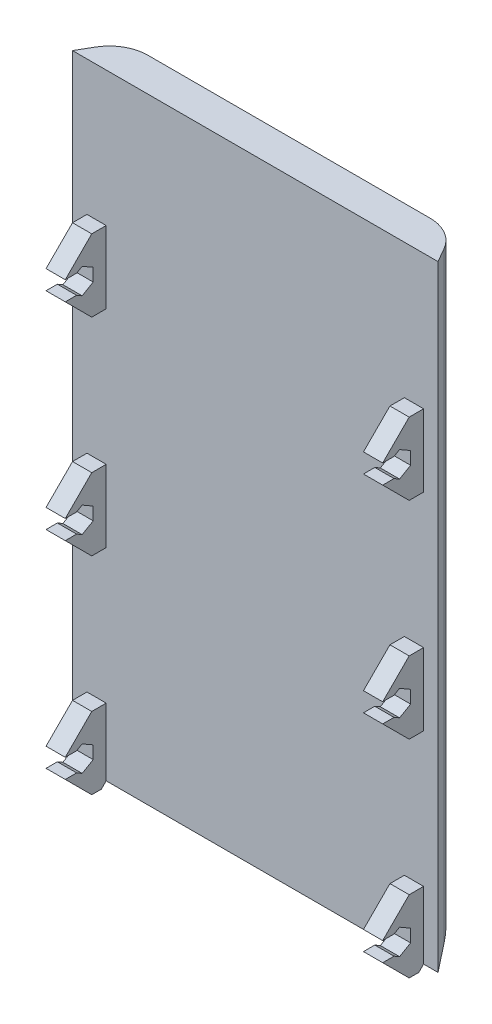
from build123d import *

# Parameters (mm, degrees)
BOSS_EXTRUDE1_DEPTH = 129
SKETCH4_W           = 37.518488727
SKETCH4_H           = 28
CUT_EXTRUDE1_DEPTH  = 149.559752288
SKETCH5_W           = 33.314858612
SKETCH5_H           = 28
CUT_EXTRUDE2_DEPTH  = 149.559752288
CUT_EXTRUDE3_DEPTH  = 145.255019101
LPATTERN1_COUNT     = 4
LPATTERN1_PITCH     = 43
CHAMFER6_SIZE       = 8
FILLET1_R           = 8
CHAMFER5_SIZE       = 7
CUT_EXTRUDE4_DEPTH  = 1


with BuildPart() as part:
    # Sketch1 → Boss-Extrude1 (new body)
    with BuildSketch(Plane(origin=(0, 0, 0), x_dir=(1, 0, 0), z_dir=(0, 1, 0))):
        Polygon((-9.215122984, 0), (-9.215122984, -10), (-5.215122984, -10), (-5.215122984, 0), (56.784877016, 0), (56.784877016, -10), (60.784877016, -10), (60.784877016, 0), (63.784877016, 0), (59.743425131, 7), (-8.1736711, 7), (-12.215122984, 0), align=None)
    extrude(amount=BOSS_EXTRUDE1_DEPTH)

    # Sketch4 → Cut-Extrude1 (cut, through all)
    with BuildSketch(Plane(origin=(60.784877016, 0, 0), x_dir=(0, 0, -1), z_dir=(1, 0, 0))):
        with Locations((-18.759244364, 115)):
            Rectangle(SKETCH4_W, SKETCH4_H)
    extrude(amount=-CUT_EXTRUDE1_DEPTH, mode=Mode.SUBTRACT)

    # Sketch5 → Cut-Extrude2 (cut, through all)
    with BuildSketch(Plane(origin=(60.784877016, 0, 0), x_dir=(0, 0, -1), z_dir=(1, 0, 0))):
        with Locations((-16.657429306, 72)):
            Rectangle(SKETCH5_W, SKETCH5_H)
    cut_extrude2 = extrude(amount=-CUT_EXTRUDE2_DEPTH, mode=Mode.SUBTRACT)

    # Sketch6 → Cut-Extrude3 (cut, symmetric)
    with BuildSketch(Plane(origin=(0, 0, 0), x_dir=(0, 0, -1), z_dir=(1, 0, 0))):
        Polygon((-7.3, 94.827905619), (-6.15, 95.491858429), (-10, 95.491858429), (-10, 91.508141571), (-6.15, 91.508141571), (-7.3, 92.172094381), align=None)
        Polygon((-5, 90.844188762), (-2.7, 92.172094381), (-2.7, 94.827905619), (-5, 96.155811238), (-7.3, 94.827905619), (-7.3, 92.172094381), align=None)
    cut_extrude3 = extrude(amount=CUT_EXTRUDE3_DEPTH, both=True, mode=Mode.SUBTRACT)

    # LPattern1: Cut-Extrude2, Cut-Extrude3 ×4
    with Locations(*[(0, -i * LPATTERN1_PITCH, 0) for i in range(1, LPATTERN1_COUNT)]):
        add(cut_extrude2, mode=Mode.SUBTRACT)
        add(cut_extrude3, mode=Mode.SUBTRACT)

    # Chamfer6
    # the kernel refuses this chamfer: 8 mm, written as the material it takes off along each edge
    with BuildSketch(Plane(origin=(80.316889035, 0, -7), x_dir=(0, -0.027495876610586365, 0.9996219169112968), z_dir=(-1, 0, 0))) as chamfer6_piece_1:
        Polygon((CHAMFER6_SIZE * 0.999621916911, CHAMFER6_SIZE * 0.0274958766106), (-CHAMFER6_SIZE * 0.0274958766106, CHAMFER6_SIZE * 0.999621916911), (0, 0), align=None)
    extrude(amount=109.064024039, mode=Mode.SUBTRACT)

    # Fillet1
    fillet1_edges = [part.edges().sort_by_distance(p)[0] for p in [
        (-8.1736711, 68.5, -7),
        (59.743425131, 68.5, -7),
    ]]
    fillet(fillet1_edges, radius=FILLET1_R)

    # Chamfer5
    # the kernel refuses this chamfer: 7 mm, written as the material it takes off along each edge
    with BuildSketch(Plane(origin=(38.7830961, 101, 10), x_dir=(0, 0.02749587661058612, -0.9996219169112968), z_dir=(1, 0, 0)), Plane(origin=(78.786657931, 86, 10), x_dir=(0, -0.027495876610586133, -0.9996219169112968), z_dir=(-1, 0, 0)), Plane(origin=(-27.2169039, 101, 10), x_dir=(0, 0.02749587661058612, -0.9996219169112968), z_dir=(1, 0, 0)), Plane(origin=(12.786657931, 86, 10), x_dir=(0, -0.027495876610586133, -0.9996219169112968), z_dir=(-1, 0, 0)), Plane(origin=(-27.2169039, 58, 10), x_dir=(0, 0.02749587661058612, -0.9996219169112968), z_dir=(1, 0, 0)), Plane(origin=(12.786657931, 43, 10), x_dir=(0, -0.027495876610586133, -0.9996219169112968), z_dir=(-1, 0, 0)), Plane(origin=(38.7830961, 58, 10), x_dir=(0, 0.02749587661058612, -0.9996219169112968), z_dir=(1, 0, 0)), Plane(origin=(78.786657931, 43, 10), x_dir=(0, -0.027495876610586133, -0.9996219169112968), z_dir=(-1, 0, 0)), Plane(origin=(38.7830961, 15, 10), x_dir=(0, 0.027495876610586365, -0.9996219169112968), z_dir=(1, 0, 0)), Plane(origin=(-27.2169039, 15, 10), x_dir=(0, 0.027495876610586365, -0.9996219169112968), z_dir=(1, 0, 0))) as chamfer5_piece_1:
        Polygon((CHAMFER5_SIZE * 0.999621916911, -CHAMFER5_SIZE * 0.0274958766106), (-CHAMFER5_SIZE * 0.0274958766106, -CHAMFER5_SIZE * 0.999621916911), (0, 0), align=None)
    extrude(amount=40.003561832, mode=Mode.SUBTRACT)
    with BuildSketch(Plane(origin=(38.7830961, 0, 10), x_dir=(0, -0.027495876610586376, -0.9996219169112968), z_dir=(1, 0, 0)), Plane(origin=(-27.2169039, 0, 10), x_dir=(0, -0.027495876610586376, -0.9996219169112968), z_dir=(1, 0, 0))) as chamfer5_piece_2:
        Polygon((CHAMFER5_SIZE * 0.999621916911, CHAMFER5_SIZE * 0.0274958766106), (-CHAMFER5_SIZE * 0.0274958766106, CHAMFER5_SIZE * 0.999621916911), (0, 0), align=None)
    extrude(amount=40.003561832, mode=Mode.SUBTRACT)

    # Sketch7 → Cut-Extrude4 (cut)
    # profile 1 of 7: a face of its own
    with BuildSketch(Plane(origin=(0, 0, -7), x_dir=(-1, 0, 0), z_dir=(0, 0, -1))):
        with BuildLine():
            Line((-27.458475756, 32.582937459), (-27.458475756, 23.255194994))
            add(Edge.make_bspline(
                [(-27.458475756, 23.255194994), (-27.459017719, 23.212565537), (-27.460030236, 23.132923345), (-27.479098997, 23.021984657), (-27.506487406, 22.926367391), (-27.54774344, 22.846359182), (-27.6036122, 22.784415703), (-27.671482176, 22.741882124), (-27.749749274, 22.713852669), (-27.806287603, 22.711949052), (-27.836064438, 22.710946481)],
                knots=[0, 0, 0, 0, 1.358012499, 2.537097539, 3.579489737, 4.521000185, 5.383446546, 6.205375314, 7.054831608, 8, 8, 8, 8], degree=3))
            Line((-27.836064438, 22.710946481), (-30.427104011, 22.710946481))
            add(Edge.make_bspline(
                [(-30.427104011, 22.710946481), (-30.469047088, 22.71266857), (-30.553454293, 22.716134141), (-30.678279457, 22.754226692), (-30.80439822, 22.807034058), (-30.881912253, 22.860472058), (-30.921875387, 22.888022552)],
                knots=[0, 0, 0, 0, 0.939454731, 1.890580155, 2.912467545, 4, 4, 4, 4], degree=3))
            Line((-30.921875387, 22.888022552), (-33.791549367, 25.114493744))
            Line((-33.791549367, 25.114493744), (-36.616954329, 22.921875331))
            add(Edge.make_bspline(
                [(-36.616954329, 22.921875331), (-36.664060971, 22.890432662), (-36.753824493, 22.830517446), (-36.891123432, 22.761854433), (-37.024995762, 22.719025322), (-37.113182283, 22.713586768), (-37.155994723, 22.710946481)],
                knots=[0, 0, 0, 0, 1.155467548, 2.201787915, 3.127011172, 4, 4, 4, 4], degree=3))
            Line((-37.155994723, 22.710946481), (-39.747034296, 22.710946481))
            add(Edge.make_bspline(
                [(-39.747034296, 22.710946481), (-39.776811131, 22.711949052), (-39.83334946, 22.713852669), (-39.911616558, 22.741882124), (-39.979486534, 22.784415703), (-40.035355294, 22.846359182), (-40.076611327, 22.926367391), (-40.103999736, 23.021984657), (-40.123068498, 23.132923345), (-40.124081015, 23.212565537), (-40.124622978, 23.255194994)],
                knots=[0, 0, 0, 0, 0.945168392, 1.794624686, 2.616553454, 3.478999815, 4.420510263, 5.462902461, 6.641987501, 8, 8, 8, 8], degree=3))
            Line((-40.124622978, 23.255194994), (-40.124622978, 32.582937459))
            add(Edge.make_bspline(
                [(-40.124622978, 32.582937459), (-40.119010254, 32.632865329), (-40.107860276, 32.732049727), (-40.021157573, 32.857534435), (-39.896846804, 32.946749415), (-39.797033317, 32.957663212), (-39.747034296, 32.9631302)],
                knots=[0, 0, 0, 0, 1.004302793, 1.99510148, 2.995697207, 4, 4, 4, 4], degree=3))
            Line((-39.747034296, 32.9631302), (-27.836064438, 32.9631302))
            add(Edge.make_bspline(
                [(-27.836064438, 32.9631302), (-27.785897864, 32.957873653), (-27.686474015, 32.947455836), (-27.564646884, 32.855807569), (-27.474675848, 32.733017263), (-27.463882439, 32.633025689), (-27.458475756, 32.582937459)],
                knots=[0, 0, 0, 0, 1.005484103, 1.992743221, 2.994515897, 4, 4, 4, 4], degree=3))
        make_face()
        with BuildLine():
            Line((-37.6247255, 25.455625587), (-34.031122875, 28.343527986))
            add(Edge.make_bspline(
                [(-34.031122875, 28.343527986), (-33.991711035, 28.358964927), (-33.91475952, 28.389105513), (-33.793930279, 28.407229359), (-33.67570208, 28.386425764), (-33.604342033, 28.354670168), (-33.567600218, 28.338319866)],
                knots=[0, 0, 0, 0, 1.053626176, 2.057202351, 2.999693572, 4, 4, 4, 4], degree=3))
            Line((-33.567600218, 28.338319866), (-29.958373234, 25.455625587))
            Line((-29.958373234, 25.455625587), (-29.958373234, 30.129913059))
            Line((-29.958373234, 30.129913059), (-37.6247255, 30.129913059))
            Line((-37.6247255, 30.129913059), (-37.6247255, 25.455625587))
        make_face(mode=Mode.SUBTRACT)
    # profile 2 of 7: a face of its own
    with BuildSketch(Plane(origin=(0, 0, -7), x_dir=(-1, 0, 0), z_dir=(0, 0, -1))):
        with BuildLine():
            Line((-39.747034296, 46.295916749), (-27.804815719, 46.295916749))
            add(Edge.make_bspline(
                [(-27.804815719, 46.295916749), (-27.754758723, 46.290488915), (-27.6548295, 46.27965328), (-27.530977752, 46.189561975), (-27.440886447, 46.065710227), (-27.430050813, 45.965781004), (-27.424622978, 45.915724008)],
                knots=[0, 0, 0, 0, 1.001849005, 2, 2.998150995, 4, 4, 4, 4], degree=3))
            Line((-27.424622978, 45.915724008), (-27.424622978, 44.23870945))
            add(Edge.make_bspline(
                [(-27.424622978, 44.23870945), (-27.429107022, 44.149470178), (-27.437783223, 43.976800635), (-27.520376171, 43.732904396), (-27.651654947, 43.514498107), (-27.777246232, 43.400850369), (-27.841272557, 43.342912854)],
                knots=[0, 0, 0, 0, 1.044498629, 2.021005967, 2.991110609, 4, 4, 4, 4], degree=3))
            Line((-27.841272557, 43.342912854), (-39.619435362, 34.283388556))
            add(Edge.make_bspline(
                [(-39.619435362, 34.283388556), (-39.648176189, 34.266566669), (-39.702276569, 34.234901941), (-39.792499547, 34.220843257), (-39.880401102, 34.223913998), (-39.964599559, 34.259705331), (-40.041536009, 34.323049911), (-40.089374108, 34.425032828), (-40.120492868, 34.552280232), (-40.12315985, 34.647693591), (-40.124622978, 34.700038136)],
                knots=[0, 0, 0, 0, 0.934697988, 1.759431507, 2.5478085, 3.39710162, 4.303891863, 5.304810184, 6.521396958, 8, 8, 8, 8], degree=3))
            Line((-40.124622978, 34.700038136), (-40.124622978, 36.942133686))
            add(Edge.make_bspline(
                [(-40.124622978, 36.942133686), (-40.121613841, 37.011180934), (-40.115868165, 37.143020457), (-40.058908956, 37.326633821), (-39.969785489, 37.487937318), (-39.882304018, 37.569988571), (-39.838176392, 37.611377073)],
                knots=[0, 0, 0, 0, 1.098314544, 2.097133062, 3.040151012, 4, 4, 4, 4], degree=3))
            Line((-39.838176392, 37.611377073), (-35.848756666, 40.517507892))
            Line((-35.848756666, 40.517507892), (-39.780887074, 43.397598111))
            add(Edge.make_bspline(
                [(-39.780887074, 43.397598111), (-39.834402206, 43.448016329), (-39.941703702, 43.549108301), (-40.047817544, 43.751319852), (-40.115594372, 43.983435025), (-40.121502614, 44.15048441), (-40.124622978, 44.23870945)],
                knots=[0, 0, 0, 0, 0.933671067, 1.872074271, 2.876162679, 4, 4, 4, 4], degree=3))
            Line((-40.124622978, 44.23870945), (-40.124622978, 45.915724008))
            add(Edge.make_bspline(
                [(-40.124622978, 45.915724008), (-40.119010254, 45.965651878), (-40.107860276, 46.064836276), (-40.021157573, 46.190320984), (-39.896846804, 46.279535964), (-39.797033317, 46.290449761), (-39.747034296, 46.295916749)],
                knots=[0, 0, 0, 0, 1.004302793, 1.99510148, 2.995697207, 4, 4, 4, 4], degree=3))
        make_face()
        Polygon((-31.575494415, 43.462699608), (-35.9763556, 43.462699608), (-33.778529068, 42.145045312), align=None, mode=Mode.SUBTRACT)
    # profile 3 of 7: a face of its own
    with BuildSketch(Plane(origin=(0, 0, -7), x_dir=(-1, 0, 0), z_dir=(0, 0, -1))):
        with BuildLine():
            Line((-27.502744774, 54.910146809), (-27.502744774, 53.032619641))
            add(Edge.make_bspline(
                [(-27.502744774, 53.032619641), (-27.503525214, 52.98832265), (-27.505002025, 52.904500399), (-27.521473075, 52.78734064), (-27.554803493, 52.689545481), (-27.591326397, 52.605032589), (-27.647956177, 52.541344825), (-27.716044721, 52.495416016), (-27.795443238, 52.464980805), (-27.853138632, 52.463233162), (-27.882937515, 52.462330528)],
                knots=[0, 0, 0, 0, 1.369609521, 2.591682885, 3.635471045, 4.55960568, 5.415368431, 6.226639522, 7.084083537, 8, 8, 8, 8], degree=3))
            Line((-27.882937515, 52.462330528), (-37.6247255, 52.462330528))
            Line((-37.6247255, 52.462330528), (-37.6247255, 47.850540494))
            add(Edge.make_bspline(
                [(-37.6247255, 47.850540494), (-37.626045607, 47.797335854), (-37.628460462, 47.700009284), (-37.661430244, 47.569929146), (-37.715390105, 47.46868768), (-37.795562871, 47.407011571), (-37.881521014, 47.37509221), (-37.971215173, 47.37195876), (-38.059323454, 47.399625993), (-38.110817922, 47.435814063), (-38.137725295, 47.454723393)],
                knots=[0, 0, 0, 0, 1.482572367, 2.712050797, 3.722825262, 4.620490972, 5.472091438, 6.248546427, 7.084814044, 8, 8, 8, 8], degree=3))
            Line((-38.137725295, 47.454723393), (-39.791303314, 48.780189868))
            add(Edge.make_bspline(
                [(-39.791303314, 48.780189868), (-39.842746725, 48.830888204), (-39.94535898, 48.932014286), (-40.050921151, 49.128449137), (-40.114335965, 49.354329575), (-40.121084843, 49.515811169), (-40.124622978, 49.600468728)],
                knots=[0, 0, 0, 0, 0.944141225, 1.883243314, 2.890279382, 4, 4, 4, 4], degree=3))
            Line((-40.124622978, 49.600468728), (-40.124622978, 54.910146809))
            add(Edge.make_bspline(
                [(-40.124622978, 54.910146809), (-40.120293048, 54.961109542), (-40.111750494, 55.061654358), (-40.022985137, 55.186105051), (-39.902607126, 55.280242096), (-39.802498252, 55.290432145), (-39.752242416, 55.29554767)],
                knots=[0, 0, 0, 0, 1.015913684, 2.004304878, 2.998137512, 4, 4, 4, 4], degree=3))
            Line((-39.752242416, 55.29554767), (-27.882937515, 55.29554767))
            add(Edge.make_bspline(
                [(-27.882937515, 55.29554767), (-27.832751838, 55.290296808), (-27.732065597, 55.279762139), (-27.609870533, 55.186334061), (-27.518355672, 55.062181793), (-27.507984275, 54.96117446), (-27.502744774, 54.910146809)],
                knots=[0, 0, 0, 0, 0.995078687, 1.996400946, 2.987806613, 4, 4, 4, 4], degree=3))
        make_face()
    # profile 4 of 7: a face of its own
    with BuildSketch(Plane(origin=(0, 0, -7), x_dir=(-1, 0, 0), z_dir=(0, 0, -1))):
        with BuildLine():
            Line((-27.458475756, 72.747956938), (-27.458475756, 63.420214473))
            add(Edge.make_bspline(
                [(-27.458475756, 63.420214473), (-27.459017719, 63.377585016), (-27.460030236, 63.297942824), (-27.479098997, 63.187004136), (-27.506487406, 63.09138687), (-27.54774344, 63.011378661), (-27.6036122, 62.949435182), (-27.671482176, 62.906901603), (-27.749749274, 62.878872148), (-27.806287603, 62.876968531), (-27.836064438, 62.87596596)],
                knots=[0, 0, 0, 0, 1.358012499, 2.537097539, 3.579489737, 4.521000185, 5.383446546, 6.205375314, 7.054831608, 8, 8, 8, 8], degree=3))
            Line((-27.836064438, 62.87596596), (-30.427104011, 62.87596596))
            add(Edge.make_bspline(
                [(-30.427104011, 62.87596596), (-30.469047088, 62.877688049), (-30.553454293, 62.88115362), (-30.678279457, 62.919246171), (-30.80439822, 62.972053538), (-30.881912253, 63.025491537), (-30.921875387, 63.053042031)],
                knots=[0, 0, 0, 0, 0.939454731, 1.890580155, 2.912467545, 4, 4, 4, 4], degree=3))
            Line((-30.921875387, 63.053042031), (-33.791549367, 65.279513223))
            Line((-33.791549367, 65.279513223), (-36.616954329, 63.08689481))
            add(Edge.make_bspline(
                [(-36.616954329, 63.08689481), (-36.664060971, 63.055452141), (-36.753824493, 62.995536925), (-36.891123432, 62.926873912), (-37.024995762, 62.884044801), (-37.113182283, 62.878606247), (-37.155994723, 62.87596596)],
                knots=[0, 0, 0, 0, 1.155467548, 2.201787915, 3.127011172, 4, 4, 4, 4], degree=3))
            Line((-37.155994723, 62.87596596), (-39.747034296, 62.87596596))
            add(Edge.make_bspline(
                [(-39.747034296, 62.87596596), (-39.776811131, 62.876968531), (-39.83334946, 62.878872148), (-39.911616558, 62.906901603), (-39.979486534, 62.949435182), (-40.035355294, 63.011378661), (-40.076611327, 63.09138687), (-40.103999736, 63.187004136), (-40.123068498, 63.297942824), (-40.124081015, 63.377585016), (-40.124622978, 63.420214473)],
                knots=[0, 0, 0, 0, 0.945168392, 1.794624686, 2.616553454, 3.478999815, 4.420510263, 5.462902461, 6.641987501, 8, 8, 8, 8], degree=3))
            Line((-40.124622978, 63.420214473), (-40.124622978, 72.747956938))
            add(Edge.make_bspline(
                [(-40.124622978, 72.747956938), (-40.119010254, 72.797884808), (-40.107860276, 72.897069206), (-40.021157573, 73.022553914), (-39.896846804, 73.111768894), (-39.797033317, 73.122682691), (-39.747034296, 73.12814968)],
                knots=[0, 0, 0, 0, 1.004302793, 1.99510148, 2.995697207, 4, 4, 4, 4], degree=3))
            Line((-39.747034296, 73.12814968), (-27.836064438, 73.12814968))
            add(Edge.make_bspline(
                [(-27.836064438, 73.12814968), (-27.785897864, 73.122893132), (-27.686474015, 73.112475315), (-27.564646884, 73.020827048), (-27.474675848, 72.898036742), (-27.463882439, 72.798045168), (-27.458475756, 72.747956938)],
                knots=[0, 0, 0, 0, 1.005484103, 1.992743221, 2.994515897, 4, 4, 4, 4], degree=3))
        make_face()
        with BuildLine():
            Line((-37.6247255, 65.620645066), (-34.031122875, 68.508547465))
            add(Edge.make_bspline(
                [(-34.031122875, 68.508547465), (-33.991711035, 68.523984406), (-33.91475952, 68.554124992), (-33.793930279, 68.572248838), (-33.67570208, 68.551445244), (-33.604342033, 68.519689647), (-33.567600218, 68.503339345)],
                knots=[0, 0, 0, 0, 1.053626176, 2.057202351, 2.999693572, 4, 4, 4, 4], degree=3))
            Line((-33.567600218, 68.503339345), (-29.958373234, 65.620645066))
            Line((-29.958373234, 65.620645066), (-29.958373234, 70.294932538))
            Line((-29.958373234, 70.294932538), (-37.6247255, 70.294932538))
            Line((-37.6247255, 70.294932538), (-37.6247255, 65.620645066))
        make_face(mode=Mode.SUBTRACT)
    # profile 5 of 7: a face of its own
    with BuildSketch(Plane(origin=(0, 0, -7), x_dir=(-1, 0, 0), z_dir=(0, 0, -1))):
        with BuildLine():
            Line((-39.747034296, 86.460936229), (-27.804815719, 86.460936229))
            add(Edge.make_bspline(
                [(-27.804815719, 86.460936229), (-27.754758723, 86.455508394), (-27.6548295, 86.444672759), (-27.530977752, 86.354581454), (-27.440886447, 86.230729706), (-27.430050813, 86.130800483), (-27.424622978, 86.080743487)],
                knots=[0, 0, 0, 0, 1.001849005, 2, 2.998150995, 4, 4, 4, 4], degree=3))
            Line((-27.424622978, 86.080743487), (-27.424622978, 84.403728929))
            add(Edge.make_bspline(
                [(-27.424622978, 84.403728929), (-27.429107022, 84.314489657), (-27.437783223, 84.141820114), (-27.520376171, 83.897923875), (-27.651654947, 83.679517586), (-27.777246232, 83.565869848), (-27.841272557, 83.507932333)],
                knots=[0, 0, 0, 0, 1.044498629, 2.021005967, 2.991110609, 4, 4, 4, 4], degree=3))
            Line((-27.841272557, 83.507932333), (-39.619435362, 74.448408035))
            add(Edge.make_bspline(
                [(-39.619435362, 74.448408035), (-39.648176189, 74.431586148), (-39.702276569, 74.39992142), (-39.792499547, 74.385862736), (-39.880401102, 74.388933477), (-39.964599559, 74.42472481), (-40.041536009, 74.48806939), (-40.089374108, 74.590052308), (-40.120492868, 74.717299711), (-40.12315985, 74.81271307), (-40.124622978, 74.865057615)],
                knots=[0, 0, 0, 0, 0.934697988, 1.759431507, 2.5478085, 3.39710162, 4.303891863, 5.304810184, 6.521396958, 8, 8, 8, 8], degree=3))
            Line((-40.124622978, 74.865057615), (-40.124622978, 77.107153165))
            add(Edge.make_bspline(
                [(-40.124622978, 77.107153165), (-40.121613841, 77.176200413), (-40.115868165, 77.308039936), (-40.058908956, 77.4916533), (-39.969785489, 77.652956798), (-39.882304018, 77.735008051), (-39.838176392, 77.776396553)],
                knots=[0, 0, 0, 0, 1.098314544, 2.097133062, 3.040151012, 4, 4, 4, 4], degree=3))
            Line((-39.838176392, 77.776396553), (-35.848756666, 80.682527371))
            Line((-35.848756666, 80.682527371), (-39.780887074, 83.56261759))
            add(Edge.make_bspline(
                [(-39.780887074, 83.56261759), (-39.834402206, 83.613035808), (-39.941703702, 83.71412778), (-40.047817544, 83.916339332), (-40.115594372, 84.148454504), (-40.121502614, 84.315503889), (-40.124622978, 84.403728929)],
                knots=[0, 0, 0, 0, 0.933671067, 1.872074271, 2.876162679, 4, 4, 4, 4], degree=3))
            Line((-40.124622978, 84.403728929), (-40.124622978, 86.080743487))
            add(Edge.make_bspline(
                [(-40.124622978, 86.080743487), (-40.119010254, 86.130671357), (-40.107860276, 86.229855755), (-40.021157573, 86.355340463), (-39.896846804, 86.444555444), (-39.797033317, 86.45546924), (-39.747034296, 86.460936229)],
                knots=[0, 0, 0, 0, 1.004302793, 1.99510148, 2.995697207, 4, 4, 4, 4], degree=3))
        make_face()
        Polygon((-31.575494415, 83.627719087), (-35.9763556, 83.627719087), (-33.778529068, 82.310064791), align=None, mode=Mode.SUBTRACT)
    # profile 6 of 7: a face of its own
    with BuildSketch(Plane(origin=(0, 0, -7), x_dir=(-1, 0, 0), z_dir=(0, 0, -1))):
        with BuildLine():
            add(Edge.make_bspline(
                [(-33.656138253, 101.626980928), (-33.427500736, 101.621329614), (-32.975951231, 101.610168506), (-32.311816834, 101.510850886), (-31.671062068, 101.34950331), (-31.058780506, 101.121173395), (-30.477166685, 100.844507479), (-29.933686303, 100.519522469), (-29.432258, 100.148779523), (-28.9724917, 99.733690186), (-28.557397906, 99.276585463), (-28.187930556, 98.780178733), (-27.869692799, 98.241335849), (-27.596287443, 97.669055097), (-27.379773578, 97.063796085), (-27.224886543, 96.433317345), (-27.13773266, 95.778163408), (-27.131114469, 95.334090072), (-27.127760152, 95.109019066)],
                knots=[0, 0, 0, 0, 1.066185187, 2.105671011, 3.125204307, 4.143812235, 5.149130938, 6.126323257, 7.093418766, 8.05395462, 9.011489287, 9.969666022, 10.935751988, 11.926619107, 12.924471131, 13.929275827, 14.950488731, 16, 16, 16, 16], degree=3))
            add(Edge.make_bspline(
                [(-27.127760152, 95.109019066), (-27.138020744, 94.872546366), (-27.158228307, 94.406828881), (-27.266015137, 93.721053203), (-27.444823078, 93.063173905), (-27.683852548, 92.433751355), (-27.978955922, 91.840207428), (-28.319249717, 91.285767637), (-28.710543861, 90.777155817), (-29.145568162, 90.314908091), (-29.617678772, 89.895586892), (-30.128043502, 89.528711787), (-30.670216948, 89.20580243), (-31.243976287, 88.932767344), (-31.844425069, 88.715905406), (-32.467519749, 88.56389255), (-33.109316313, 88.476179786), (-33.543896288, 88.46945255), (-33.762904708, 88.466062331)],
                knots=[0, 0, 0, 0, 1.088353167, 2.143440223, 3.185798891, 4.219708311, 5.235920288, 6.231136966, 7.208012579, 8.182730829, 9.147482911, 10.108466885, 11.070048114, 12.04716042, 13.027401475, 14.001792435, 14.992994831, 16, 16, 16, 16], degree=3))
            add(Edge.make_bspline(
                [(-33.762904708, 88.466062331), (-33.983831008, 88.474192336), (-34.421158403, 88.490285819), (-35.065219884, 88.59997493), (-35.690535274, 88.762060795), (-36.29142313, 88.990238785), (-36.864344123, 89.270816637), (-37.402827385, 89.602944515), (-37.905112444, 89.983066636), (-38.372605909, 90.407340193), (-38.797716478, 90.878505642), (-39.173549217, 91.395872016), (-39.506288876, 91.951731784), (-39.786027948, 92.548586546), (-40.015213153, 93.176627623), (-40.170775631, 93.835872247), (-40.275585295, 94.517143047), (-40.286007921, 94.981018347), (-40.29128281, 95.215785521)],
                knots=[0, 0, 0, 0, 1.016317669, 2.011818244, 2.999063003, 3.985014075, 4.963933395, 5.930560232, 6.89159212, 7.858590252, 8.831509843, 9.806190672, 10.796726687, 11.808040005, 12.83522552, 13.866975104, 14.920476631, 16, 16, 16, 16], degree=3))
            add(Edge.make_bspline(
                [(-40.29128281, 95.215785521), (-40.286040982, 95.43842815), (-40.275687721, 95.878175066), (-40.170221913, 96.524731481), (-40.01472726, 97.15200783), (-39.785442166, 97.751361766), (-39.505461931, 98.32206054), (-39.173431934, 98.854083366), (-38.796546331, 99.348220763), (-38.370506885, 99.799130614), (-37.901627582, 100.20728371), (-37.39416374, 100.573036035), (-36.844359088, 100.884354636), (-36.260255185, 101.150821589), (-35.645369883, 101.364847097), (-35.002141314, 101.515231764), (-34.336826131, 101.608960984), (-33.884736897, 101.620929205), (-33.656138253, 101.626980928)],
                knots=[0, 0, 0, 0, 1.038783637, 2.05172704, 3.051520448, 4.05203663, 5.04178028, 6.015795449, 6.975665697, 7.939106566, 8.907234043, 9.874580579, 10.854942561, 11.852580973, 12.869086358, 13.88959216, 14.932873571, 16, 16, 16, 16], degree=3))
        make_face()
        with BuildLine():
            add(Edge.make_bspline(
                [(-33.742072229, 98.793763787), (-33.884665872, 98.789799549), (-34.165060027, 98.782004328), (-34.57824723, 98.718957628), (-34.977250383, 98.622726344), (-35.357296831, 98.478951373), (-35.718188968, 98.308662598), (-36.056010484, 98.109371769), (-36.369726212, 97.885555644), (-36.656019801, 97.635435621), (-36.91254474, 97.364892854), (-37.142412483, 97.079844955), (-37.336627373, 96.776833065), (-37.503125597, 96.461829208), (-37.629759495, 96.131728778), (-37.725175353, 95.793050138), (-37.78046607, 95.442390255), (-37.78944232, 95.205555301), (-37.793989391, 95.085582528)],
                knots=[0, 0, 0, 0, 1.125595295, 2.213354933, 3.294071316, 4.361200397, 5.416038144, 6.442424975, 7.454495379, 8.455359638, 9.439676808, 10.395730159, 11.342671095, 12.277851744, 13.204627749, 14.129347831, 15.052389331, 16, 16, 16, 16], degree=3))
            add(Edge.make_bspline(
                [(-37.793989391, 95.085582528), (-37.787303977, 94.958543132), (-37.774026895, 94.706245795), (-37.703376517, 94.333673833), (-37.597223273, 93.969060335), (-37.447584055, 93.6168157), (-37.266571989, 93.279163916), (-37.053647887, 92.963188692), (-36.815994035, 92.666022584), (-36.547819411, 92.393366295), (-36.253548783, 92.146373371), (-35.935650049, 91.925326862), (-35.594338493, 91.733775121), (-35.233182688, 91.5679738), (-34.853702543, 91.442566806), (-34.46386342, 91.348994741), (-34.063683295, 91.299643265), (-33.794274007, 91.295936243), (-33.658742313, 91.294071353)],
                knots=[0, 0, 0, 0, 0.982686994, 1.951593922, 2.924259465, 3.913980749, 4.904952902, 5.882238771, 6.856015191, 7.843207167, 8.834042939, 9.822671262, 10.832488173, 11.856766417, 12.890391598, 13.917656082, 14.952435531, 16, 16, 16, 16], degree=3))
            add(Edge.make_bspline(
                [(-33.658742313, 91.294071353), (-33.523149576, 91.298476825), (-33.254239365, 91.307213846), (-32.855891762, 91.364990644), (-32.468729576, 91.464856659), (-32.094249687, 91.603322138), (-31.737453613, 91.774359266), (-31.401101261, 91.972844863), (-31.091851652, 92.200107637), (-30.805360255, 92.450583024), (-30.548672869, 92.728074987), (-30.314039119, 93.02447772), (-30.114799722, 93.347904698), (-29.939006582, 93.687841327), (-29.798841118, 94.044412894), (-29.699474161, 94.4129653), (-29.637611602, 94.788368326), (-29.629243342, 95.041950432), (-29.62505357, 95.168912444)],
                knots=[0, 0, 0, 0, 1.051113245, 2.084588672, 3.112793023, 4.145326028, 5.174674736, 6.176378887, 7.168316728, 8.145700102, 9.121692643, 10.094897558, 11.071377116, 12.061487341, 13.05866092, 14.034815827, 15.016083042, 16, 16, 16, 16], degree=3))
            add(Edge.make_bspline(
                [(-29.62505357, 95.168912444), (-29.631090329, 95.28465054), (-29.643155016, 95.515957449), (-29.708758268, 95.857647489), (-29.804140455, 96.194513157), (-29.941138063, 96.521720063), (-30.108970733, 96.837609765), (-30.309067081, 97.138118646), (-30.541561512, 97.419533979), (-30.805079265, 97.681573967), (-31.093811534, 97.924856415), (-31.410686608, 98.141558822), (-31.752888003, 98.331304171), (-32.116601139, 98.495217922), (-32.499553962, 98.628817122), (-32.899702991, 98.725227799), (-33.315841708, 98.784226442), (-33.59865408, 98.790554658), (-33.742072229, 98.793763787)],
                knots=[0, 0, 0, 0, 0.916735683, 1.832130506, 2.74793811, 3.684833763, 4.634973209, 5.576697216, 6.538597729, 7.520356388, 8.515687511, 9.524221139, 10.554994287, 11.610204405, 12.679667404, 13.761603208, 14.864877357, 16, 16, 16, 16], degree=3))
        make_face(mode=Mode.SUBTRACT)
    # profile 7 of 7: a face of its own
    with BuildSketch(Plane(origin=(0, 0, -7), x_dir=(-1, 0, 0), z_dir=(0, 0, -1))):
        with BuildLine():
            add(Edge.make_bspline(
                [(-27.830856318, 113.793148654), (-27.781365348, 113.788061933), (-27.681402061, 113.777787627), (-27.562858995, 113.679871311), (-27.472328207, 113.556967836), (-27.463044553, 113.45696335), (-27.458475756, 113.407747793)],
                knots=[0, 0, 0, 0, 0.988874022, 1.997356267, 3.014431942, 4, 4, 4, 4], degree=3))
            Line((-27.458475756, 113.407747793), (-27.458475756, 104.014903832))
            add(Edge.make_bspline(
                [(-27.458475756, 104.014903832), (-27.459502495, 103.97304064), (-27.461450947, 103.893596522), (-27.488637415, 103.78292675), (-27.529171859, 103.685304178), (-27.606404143, 103.590820582), (-27.701308517, 103.500732451), (-27.793182768, 103.479401992), (-27.830856318, 103.470655318)],
                knots=[0, 0, 0, 0, 1.046710349, 1.986350693, 2.843752827, 3.666478058, 5.043126277, 6, 6, 6, 6], degree=3))
            Line((-27.830856318, 103.470655318), (-30.356794395, 103.470655318))
            add(Edge.make_bspline(
                [(-30.356794395, 103.470655318), (-30.400458076, 103.47430958), (-30.49129455, 103.481911786), (-30.628741575, 103.525581783), (-30.767772604, 103.600338952), (-30.855085706, 103.667215967), (-30.901042908, 103.702416647)],
                knots=[0, 0, 0, 0, 0.870817169, 1.81161913, 2.84814696, 4, 4, 4, 4], degree=3))
            Line((-30.901042908, 103.702416647), (-34.458188694, 106.421055154))
            Line((-34.458188694, 106.421055154), (-39.575166345, 102.491528806))
            add(Edge.make_bspline(
                [(-39.575166345, 102.491528806), (-39.604038496, 102.475493836), (-39.658701155, 102.445135374), (-39.748590802, 102.420879418), (-39.83724035, 102.431315761), (-39.922439922, 102.461005301), (-39.997084734, 102.524324795), (-40.044801151, 102.621667961), (-40.076139709, 102.743904098), (-40.078865866, 102.835010643), (-40.08035396, 102.884741847)],
                knots=[0, 0, 0, 0, 0.952550553, 1.80343143, 2.633770131, 3.490167907, 4.378948229, 5.376891149, 6.568156004, 8, 8, 8, 8], degree=3))
            Line((-40.08035396, 102.884741847), (-40.08035396, 105.129441457))
            add(Edge.make_bspline(
                [(-40.08035396, 105.129441457), (-40.077599955, 105.198554712), (-40.0723311, 105.330779505), (-40.011094865, 105.516036574), (-39.9175891, 105.680505544), (-39.82673149, 105.765975261), (-39.780887074, 105.809101084)],
                knots=[0, 0, 0, 0, 1.076472818, 2.059465968, 3.020856401, 4, 4, 4, 4], degree=3))
            Line((-39.780887074, 105.809101084), (-34.702970322, 109.709982774))
            add(Edge.make_bspline(
                [(-34.702970322, 109.709982774), (-34.662330941, 109.732344106), (-34.585289704, 109.774735121), (-34.457123372, 109.798811445), (-34.331784907, 109.77272014), (-34.26085189, 109.728078543), (-34.223823306, 109.704774654)],
                knots=[0, 0, 0, 0, 1.081207348, 2.049675668, 2.981888088, 4, 4, 4, 4], degree=3))
            Line((-34.223823306, 109.704774654), (-29.958373234, 106.267415622))
            Line((-29.958373234, 106.267415622), (-29.958373234, 110.959931513))
            Line((-29.958373234, 110.959931513), (-39.702765278, 110.959931513))
            add(Edge.make_bspline(
                [(-39.702765278, 110.959931513), (-39.732616685, 110.960695513), (-39.789594317, 110.962153768), (-39.867592645, 110.99373227), (-39.935381963, 111.03878047), (-39.991134605, 111.103362911), (-40.032285566, 111.185872594), (-40.060353338, 111.285660777), (-40.078495277, 111.401960496), (-40.079711324, 111.485874922), (-40.08035396, 111.530220625)],
                knots=[0, 0, 0, 0, 0.918339414, 1.752842212, 2.566259426, 3.424285998, 4.362896805, 5.401461119, 6.626767336, 8, 8, 8, 8], degree=3))
            Line((-40.08035396, 111.530220625), (-40.08035396, 113.407747793))
            add(Edge.make_bspline(
                [(-40.08035396, 113.407747793), (-40.075790246, 113.458518089), (-40.066720416, 113.559417923), (-39.980275983, 113.687303084), (-39.854408951, 113.777249635), (-39.753661593, 113.787812451), (-39.702765278, 113.793148654)],
                knots=[0, 0, 0, 0, 1.006786131, 2.000865917, 2.990062262, 4, 4, 4, 4], degree=3))
            Line((-39.702765278, 113.793148654), (-27.830856318, 113.793148654))
        make_face()
    extrude(amount=-CUT_EXTRUDE4_DEPTH, mode=Mode.SUBTRACT)


solid = part.part
